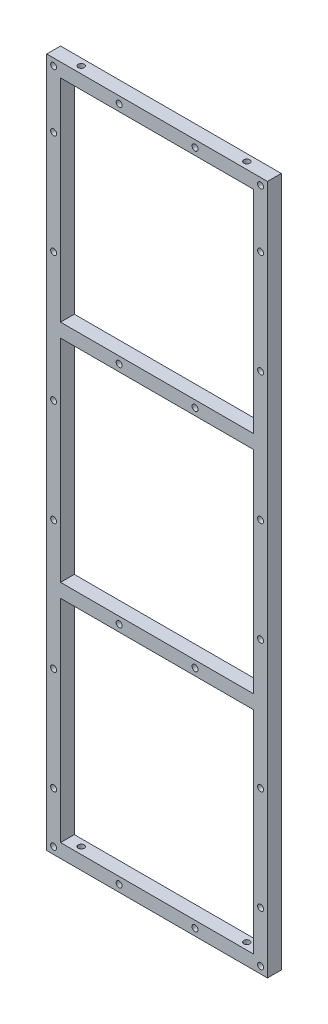
from build123d import *

# Parameters (mm, degrees)
SKETCH1_W           = 96
SKETCH1_H           = 300
SKETCH1_W_2         = 84
SKETCH1_H_2         = 92
BOSS_EXTRUDE1_DEPTH = 6
SKETCH2_R           = 1.3
CUT_EXTRUDE1_DEPTH  = 6
SKETCH4_R           = 1.3
CUT_EXTRUDE5_DEPTH  = 10
SKETCH3_R           = 1.3
CUT_EXTRUDE6_DEPTH  = 10


with BuildPart() as part:
    # Sketch1 → Boss-Extrude1 (new body)
    with BuildSketch(Plane.XY):
        Rectangle(SKETCH1_W, SKETCH1_H)
        with Locations((0, 98)):
            Rectangle(SKETCH1_W_2, SKETCH1_H_2, mode=Mode.SUBTRACT)
        with Locations((0, -98)):
            Rectangle(SKETCH1_W_2, SKETCH1_H_2, mode=Mode.SUBTRACT)
        Rectangle(SKETCH1_W_2, SKETCH1_H_2, mode=Mode.SUBTRACT)
    extrude(amount=BOSS_EXTRUDE1_DEPTH)

    # Sketch2 → Cut-Extrude1 (cut)
    with BuildSketch(Plane.XY.offset(6)):
        with Locations((-45, 147)):
            Circle(SKETCH2_R)
        with Locations((45, 147)):
            Circle(SKETCH2_R)
        with Locations((-45, -147)):
            Circle(SKETCH2_R)
        with Locations((45, -147)):
            Circle(SKETCH2_R)
    extrude(amount=-CUT_EXTRUDE1_DEPTH, mode=Mode.SUBTRACT)

    # Sketch4 → Cut-Extrude5 (cut)
    with BuildSketch(Plane(origin=(0, 150, 0), x_dir=(1, 0, 0), z_dir=(0, 1, 0))):
        with Locations((-36, -3)):
            Circle(SKETCH4_R)
        with Locations((36, -3)):
            Circle(SKETCH4_R)
    cut_extrude5 = extrude(amount=-CUT_EXTRUDE5_DEPTH, mode=Mode.SUBTRACT)

    # Mirror1: Cut-Extrude5 across plane
    add(cut_extrude5.mirror(Plane.ZX), mode=Mode.SUBTRACT)

    # Sketch3 → Cut-Extrude6 (cut)
    with BuildSketch(Plane.XY.offset(6)):
        with Locations((-45.000000047, 122)):
            Circle(SKETCH3_R)
        with Locations((-16.5, 147)):
            Circle(SKETCH3_R)
        with Locations((16.5, 147)):
            Circle(SKETCH3_R)
        with Locations((-16.5, 49)):
            Circle(SKETCH3_R)
        with Locations((16.5, 49)):
            Circle(SKETCH3_R)
        with Locations((-16.5, -49)):
            Circle(SKETCH3_R)
        with Locations((16.5, -49)):
            Circle(SKETCH3_R)
        with Locations((-16.5, -147)):
            Circle(SKETCH3_R)
        with Locations((16.5, -147)):
            Circle(SKETCH3_R)
        with Locations((-45.000000047, 21)):
            Circle(SKETCH3_R)
        with Locations((44.999999953, 122)):
            Circle(SKETCH3_R)
        with Locations((44.999999953, 77)):
            Circle(SKETCH3_R)
        with Locations((-45.000000047, 77)):
            Circle(SKETCH3_R)
        with Locations((44.999999953, 21)):
            Circle(SKETCH3_R)
        with Locations((44.999999953, -24)):
            Circle(SKETCH3_R)
        with Locations((-45.000000047, -24)):
            Circle(SKETCH3_R)
        with Locations((-45.000000047, -80)):
            Circle(SKETCH3_R)
        with Locations((44.999999953, -80)):
            Circle(SKETCH3_R)
        with Locations((44.999999953, -125)):
            Circle(SKETCH3_R)
        with Locations((-45.000000047, -125)):
            Circle(SKETCH3_R)
    extrude(amount=-CUT_EXTRUDE6_DEPTH, mode=Mode.SUBTRACT)


solid = part.part
